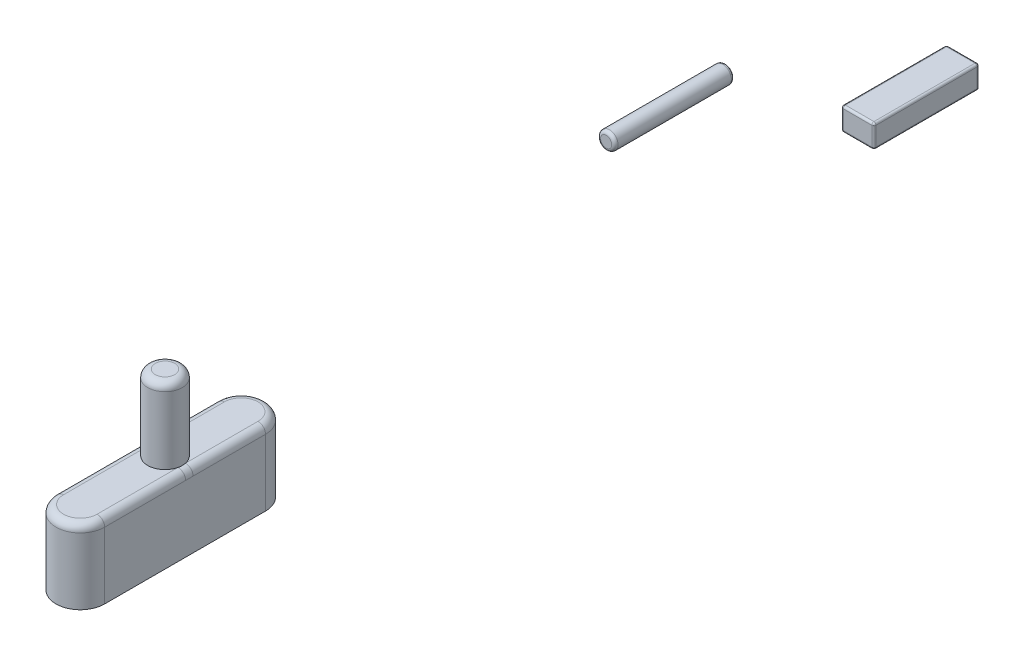
from build123d import *

# Parameters (mm, degrees)
BOSS_EXTRUDE2_START     = -4067.22193323
BOSS_EXTRUDE2_OUTLINE_R = 20.727528706
BOSS_EXTRUDE2_DEPTH     = 283.464
FILLET1_R               = 7.62
BOSS_EXTRUDE4_START     = 1914.607462
BOSS_EXTRUDE4_DEPTH     = 175.26
SKETCH36_R              = 40.778815158
BOSS_EXTRUDE5_DEPTH     = 177.546
FILLET2_R               = 17.78
FILLET3_R               = 17.78
BOSS_EXTRUDE6_DEPTH     = 54.61
FILLET4_R               = 5.08


with BuildPart() as part:
    # Boss-Extrude2: read off the stored shape, not the designer's step
    # Boss-Extrude2 outline → Boss-Extrude2 (new body)
    with BuildSketch(Plane.XY.offset(BOSS_EXTRUDE2_START)):
        with Locations((0, 2211.367989324)):
            Circle(BOSS_EXTRUDE2_OUTLINE_R)
    extrude(amount=BOSS_EXTRUDE2_DEPTH)

    # Fillet1
    fillet1_edges = [part.edges().sort_by_distance(p)[0] for p in [
        (-20.727528706, 2211.367989324, -4067.22193323),
        (-20.727528706, 2211.367989324, -3783.75793323),
    ]]
    fillet(fillet1_edges, radius=FILLET1_R)


with BuildPart() as body_2:
    # Sketch35 → Boss-Extrude4 (new body)
    with BuildSketch(Plane(origin=(0, 0, 0), x_dir=(1, 0, 0), z_dir=(0, 1, 0)).offset(BOSS_EXTRUDE4_START)):
        with BuildLine():
            Line((57.587278951, 2919.566705498), (57.587278951, 2538.566705498))
            ThreePointArc((57.587278951, 2538.566705498), (0, 2480.979426547), (-57.587278951, 2538.566705498))
            Line((-57.587278951, 2538.566705498), (-57.587278951, 2919.566705498))
            ThreePointArc((-57.587278951, 2919.566705498), (0, 2977.153984449), (57.587278951, 2919.566705498))
        make_face()
    extrude(amount=BOSS_EXTRUDE4_DEPTH)


with BuildPart() as boss_extrude5_tool:
    # Sketch36 → Boss-Extrude5 (new body)
    with BuildSketch(Plane(origin=(0, 2089.867462365, 0), x_dir=(1, 0, 0), z_dir=(0, 1, 0))):
        with Locations(Location((0, 2739.118513081, 0), (0, 0, 90))):
            Circle(SKETCH36_R)
    extrude(amount=BOSS_EXTRUDE5_DEPTH)


with BuildPart() as body_2_1:
    add(body_2.part)


with BuildPart() as body_2_2:
    # Boss-Extrude5: joined with boss_extrude5_tool
    add(body_2_1.part.fuse(boss_extrude5_tool.part, tol=0.00001))

    # Fillet2
    fillet2_edges = [body_2_2.edges().sort_by_distance(p)[0] for p in [
        (0, 2267.413462365, -2698.339697923),
    ]]
    fillet(fillet2_edges, radius=FILLET2_R)

    # Fillet3
    fillet3_edges = [body_2_2.edges().sort_by_distance(p)[0] for p in [
        (0, 2089.867462, -2480.979426547),
        (57.587278951, 2089.867462, -2729.066705498),
        (0, 2089.867462, -2977.153984449),
        (-57.587278951, 2089.867462, -2729.066705498),
    ]]
    fillet(fillet3_edges, radius=FILLET3_R)


with BuildPart() as body_3:
    # 3DSketch17 → Boss-Extrude6 (new body)
    with BuildSketch(Plane(origin=(-38.73894357, 1914.607462365, -4379.117415927), x_dir=(0.29662791930000043, 1.8532370570116771e-13, -0.9549931295521201), z_dir=(0, -1, 0))):
        Polygon((0, 0), (238.213427388, -73.990849912), (261.195531843, 0), (22.982104454, 73.990849912), align=None)
    extrude(amount=-BOSS_EXTRUDE6_DEPTH)

    # Fillet4
    fillet4_edges = [body_3.edges().sort_by_distance(p)[0] for p in [
        (0, 1914.607462365, -4379.117415927),
        (38.73894357, 1941.912462365, -4628.557354306),
        (38.73894357, 1914.607462365, -4503.837385117),
        (38.73894357, 1941.912462365, -4379.117415927),
        (38.73894357, 1969.217462365, -4503.837385117),
        (0, 1969.217462365, -4379.117415927),
        (0, 1969.217462365, -4628.557354306),
        (-38.73894357, 1941.912462365, -4379.117415927),
        (-38.73894357, 1914.607462365, -4503.837385117),
        (-38.73894357, 1941.912462365, -4628.557354306),
        (-38.73894357, 1969.217462365, -4503.837385117),
    ]]
    fillet(fillet4_edges, radius=FILLET4_R)


solid = Compound([part.part, body_2_2.part, body_3.part])
